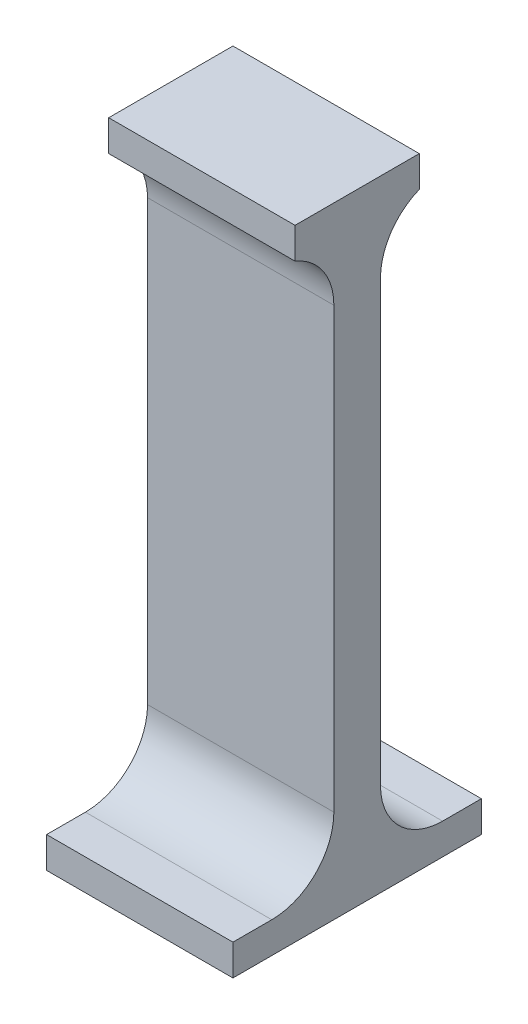
from build123d import *

# Parameters (mm, degrees)
SKETCH1_W           = 30
SKETCH1_H           = 99.95
BOSS_EXTRUDE1_DEPTH = 3.75
SKETCH2_W           = 30
SKETCH2_H           = 5
BOSS_EXTRUDE2_DEPTH = 20
SKETCH3_W           = 30
SKETCH3_H           = 5
BOSS_EXTRUDE3_DEPTH = 10
FILLET1_R           = 10
FILLET2_R           = 10


with BuildPart() as part:
    # Sketch1 → Boss-Extrude1 (new, symmetric)
    with BuildSketch(Plane.XY):
        with Locations((0, 49.975)):
            Rectangle(SKETCH1_W, SKETCH1_H)
    extrude(amount=BOSS_EXTRUDE1_DEPTH, both=True)

    # Sketch2 → Boss-Extrude2 (add, symmetric)
    with BuildSketch(Plane.XY):
        with Locations((0, 2.5)):
            Rectangle(SKETCH2_W, SKETCH2_H)
    extrude(amount=BOSS_EXTRUDE2_DEPTH, both=True)

    # Sketch3 → Boss-Extrude3 (add, symmetric)
    with BuildSketch(Plane.XY):
        with Locations((0, 97.45)):
            Rectangle(SKETCH3_W, SKETCH3_H)
    extrude(amount=BOSS_EXTRUDE3_DEPTH, both=True)

    # Fillet1
    # the kernel refuses this fillet: 10 mm, written as the material it adds along each edge
    with BuildSketch(Plane(origin=(15, 94.95, -3.75), x_dir=(0, 0, -1), z_dir=(-1, 0, 0))) as fillet1_piece_1:
        with BuildLine():
            CenterArc((10, 9.270248109), FILLET1_R, 180, 67.975687163)
            Line((0, 9.270248109), (-0.2, 9.270248109))
            Line((-0.2, 9.270248109), (-0.2, 0))
            Line((-0.2, 0), (0, -0.2))
            ThreePointArc((0, -0.2), (3.125, -0.2), (6.175, -0.185404962))
            Line((6.175, -0.185404962), (6.25, 0))
        make_face()
    extrude(amount=30)
    with BuildSketch(Plane(origin=(15, 94.95, 3.75), x_dir=(0, -1, 0), z_dir=(-1, 0, 0))) as fillet1_piece_2:
        with BuildLine():
            CenterArc((9.270248109, 10), FILLET1_R, 202.024312837, 67.975687163)
            Line((0, 6.25), (-0.185404962, 6.175))
            ThreePointArc((-0.185404962, 6.175), (-0.2, 3.125), (-0.2, 0))
            Line((-0.2, 0), (0, -0.2))
            Line((0, -0.2), (9.270248109, -0.2))
            Line((9.270248109, -0.2), (9.270248109, 0))
        make_face()
    extrude(amount=30)

    # Fillet2
    fillet2_edges = [part.edges().sort_by_distance(p)[0] for p in [
        (0, 5, -3.75),
        (0, 5, 3.75),
    ]]
    fillet(fillet2_edges, radius=FILLET2_R)


solid = part.part
